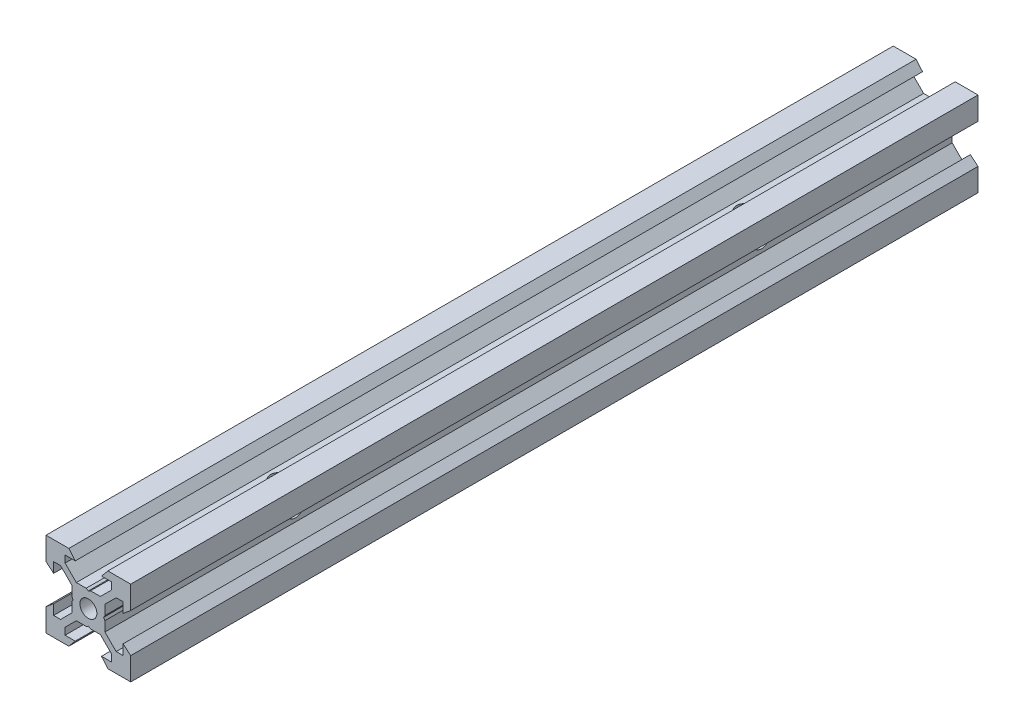
from build123d import *

# Parameters (mm, degrees)
SKETCH1_R               = 2
BOSS_EXTRUDE1_DEPTH     = 200
CUT_EXTRUDE1_DEPTH      = 201.731686587
CUT_EXTRUDE1_DEPTH_BACK = 201.731686587
SKETCH2_R               = 2
CUT_EXTRUDE2_DEPTH      = 201.731686587
CUT_EXTRUDE2_DEPTH_BACK = 201.731686587
SKETCH3_R               = 2


with BuildPart() as part:
    # Sketch1 → Boss-Extrude1 (new body)
    with BuildSketch(Plane.XY):
        Polygon((10, 4.610379336), (10, 10), (4.610379336, 10), (3.1, 8.2), (5.5, 8.2), (5.5, 6.560660172), (2.839339828, 3.9), (0.519615242, 3.9), (0, 3.6), (-0.519615242, 3.9), (-2.839339828, 3.9), (-5.5, 6.560660172), (-5.5, 8.2), (-3.1, 8.2), (-4.610379336, 10), (-10, 10), (-10, 4.610379336), (-8.2, 3.1), (-8.2, 5.5), (-6.560660172, 5.5), (-3.9, 2.839339828), (-3.9, 0.519615242), (-3.6, 0), (-3.9, -0.519615242), (-3.9, -2.839339828), (-6.560660172, -5.5), (-8.2, -5.5), (-8.2, -3.1), (-10, -4.610379336), (-10, -10), (-4.610379336, -10), (-3.1, -8.2), (-5.5, -8.2), (-5.5, -6.560660172), (-2.839339828, -3.9), (-0.519615242, -3.9), (0, -3.6), (0.519615242, -3.9), (2.839339828, -3.9), (5.5, -6.560660172), (5.5, -8.2), (3.1, -8.2), (4.610379336, -10), (10, -10), (10, -4.610379336), (8.2, -3.1), (8.2, -5.5), (6.560660172, -5.5), (3.9, -2.839339828), (3.9, -0.519615242), (3.6, 0), (3.9, 0.519615242), (3.9, 2.839339828), (6.560660172, 5.5), (8.2, 5.5), (8.2, 3.1), align=None)
        Circle(SKETCH1_R, mode=Mode.SUBTRACT)
    extrude(amount=BOSS_EXTRUDE1_DEPTH)

    # Sketch2 → Cut-Extrude1 (cut, two sides: drawn at the far end of the back side and taken through both)
    with BuildSketch(Plane(origin=(0, -3.9, 0), x_dir=(-1, 0, 0), z_dir=(0, -1, 0)).offset(-CUT_EXTRUDE1_DEPTH_BACK)):
        with Locations((0, -155)):
            Circle(SKETCH2_R)
        with Locations((0, -45)):
            Circle(SKETCH2_R)
    extrude(amount=CUT_EXTRUDE1_DEPTH + CUT_EXTRUDE1_DEPTH_BACK, mode=Mode.SUBTRACT)

    # Sketch3 → Cut-Extrude2 (cut, two sides: drawn at the far end of the back side and taken through both)
    with BuildSketch(Plane(origin=(3.9, 0, 0), x_dir=(0, 0, -1), z_dir=(1, 0, 0)).offset(-CUT_EXTRUDE2_DEPTH_BACK)):
        with Locations((-45, 0)):
            Circle(SKETCH3_R)
        with Locations((-155, 0)):
            Circle(SKETCH3_R)
    extrude(amount=CUT_EXTRUDE2_DEPTH + CUT_EXTRUDE2_DEPTH_BACK, mode=Mode.SUBTRACT)


solid = part.part
